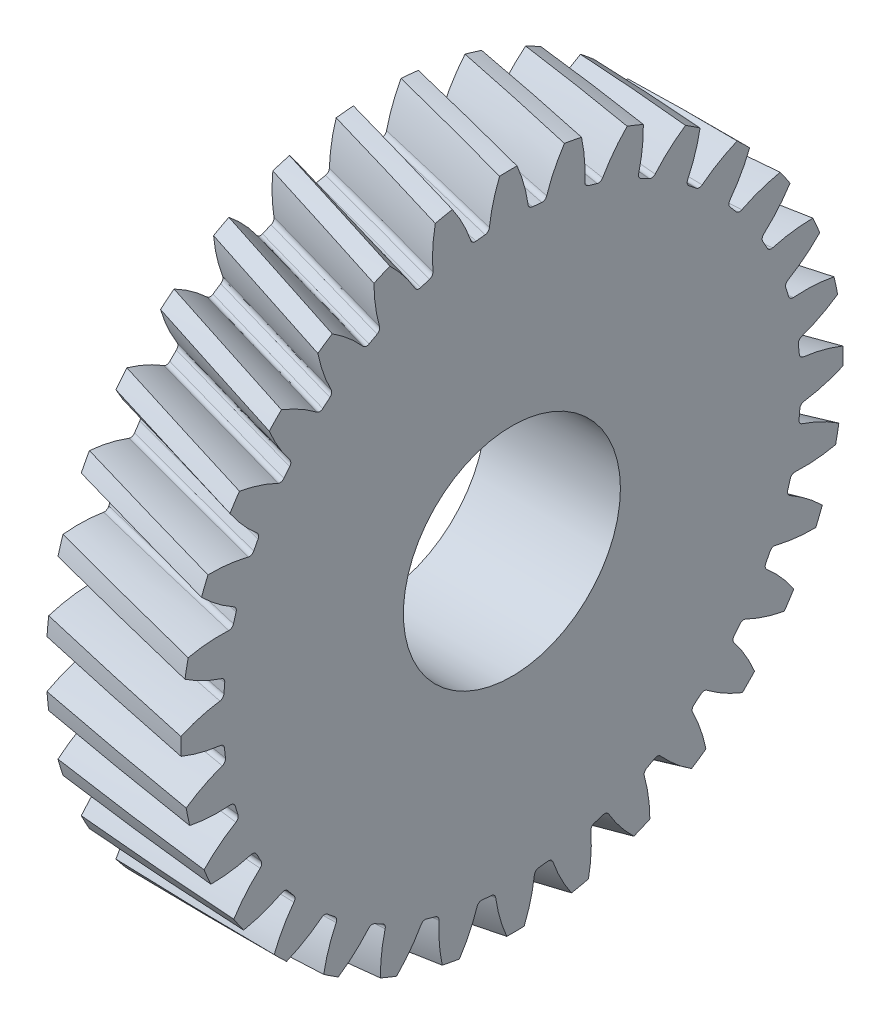
from build123d import *

# Parameters (mm, degrees)
BASPROSKE_W            = 25
BASPROSKE_H            = 61.475466103
TOOTHCUTRH_PITCH       = 1441.548458742
TOOTHCUTRH_HEIGHT      = 25
TOOTHCUTRH_RADIUS      = 61.475466103
TOOTHCUTRH_START_ANGLE = -90
TEETHCUTSRH_COUNT      = 32
TEETHCUTSRH_ANGLE      = 348.75
BORSKE_R               = 20
BORE_DEPTH             = 62.5000025
SKETCH3_R              = 20.15
CUT_EXTRUDE1_DEPTH     = 91.462510991


with BuildPart() as part:
    # BasProSke → Base-Revolve (revolve)
    with BuildSketch(Plane(origin=(0, 0, 0), x_dir=(1, 0, 0), z_dir=(0, 1, 0)), mode=Mode.PRIVATE) as base_revolve_sk:
        with Locations((12.5, 30.737733052)):
            Rectangle(BASPROSKE_W, BASPROSKE_H)
    revolve(base_revolve_sk.sketch.rotate(Axis((-10, 0, 0), (1, 0, 0)), 180), axis=Axis((-10, 0, 0), (1, 0, 0)))

    # ToothCutRH: sweep along a helix
    with BuildLine() as toothcutrh_path:
        add(Helix(TOOTHCUTRH_PITCH, TOOTHCUTRH_HEIGHT, TOOTHCUTRH_RADIUS, center=(0, 0, 0), direction=(1, 0, 0), mode=Mode.PRIVATE).rotate(Axis((0, 0, 0), (1, 0, 0)), TOOTHCUTRH_START_ANGLE))
    # TooCutSkeRH → ToothCutRH (sweep, cut)
    with BuildSketch(Plane(origin=(0, 0, 0), x_dir=(0, 0, -1), z_dir=(1, 0, 0))):
        with BuildLine():
            ThreePointArc((0.863433126, 53.593511265), (0, 53.600466103), (-0.863433126, 53.593511265))
            ThreePointArc((-0.863433126, 53.593511265), (-1.416549862, 53.77885503), (-1.73064632, 54.270417693))
            ThreePointArc((-1.73064632, 54.270417693), (-3.219050706, 58.83769385), (-5.466225161, 63.083346461))
            ThreePointArc((-5.466225161, 63.083346461), (0, 63.319730086), (5.466225161, 63.083346461))
            ThreePointArc((5.466225161, 63.083346461), (3.219050706, 58.83769385), (1.73064632, 54.270417693))
            ThreePointArc((1.73064632, 54.270417693), (1.416549862, 53.77885503), (0.863433126, 53.593511265))
        make_face()
    toothcutrh = sweep(path=toothcutrh_path.line, is_frenet=True, mode=Mode.SUBTRACT)

    # TeethCutsRH: ToothCutRH ×32 about axis
    teethcutsrh_axis = Axis((-10, 0, 0), (1, 0, 0))
    for i in range(1, TEETHCUTSRH_COUNT):
        add(toothcutrh.rotate(teethcutsrh_axis, i * TEETHCUTSRH_ANGLE / (TEETHCUTSRH_COUNT - 1)), mode=Mode.SUBTRACT)

    # BorSke → Bore (cut, symmetric)
    with BuildSketch(Plane(origin=(0, 0, 0), x_dir=(0, 0, -1), z_dir=(1, 0, 0))):
        with Locations(Location((0, 0, 0), (0, 0, 180))):
            Circle(BORSKE_R)
    extrude(amount=BORE_DEPTH, both=True, mode=Mode.SUBTRACT)

    # Sketch3 → Cut-Extrude1 (cut, through all)
    with BuildSketch(Plane(origin=(25, 0, 0), x_dir=(0, 0, -1), z_dir=(1, 0, 0))):
        Circle(SKETCH3_R)
    extrude(amount=-CUT_EXTRUDE1_DEPTH, mode=Mode.SUBTRACT)


solid = part.part
